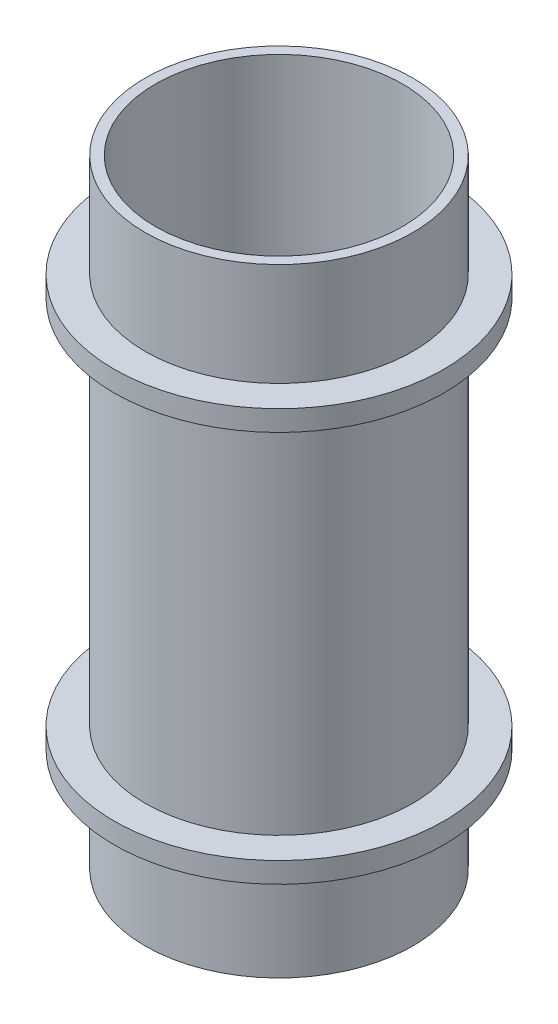
from build123d import *

# Parameters (mm, degrees)
SKETCH_1_R      = 13
SKETCH_1_R_2    = 12
EXTRUDE_1_DEPTH = 60
EXTRUDE_START   = -12
SKETCH_2_R      = 16
SKETCH_2_R_2    = 12
EXTRUDE_3_DEPTH = 2
EXTRUDE_START_2 = -10
SKETCH_3_R      = 16
SKETCH_3_R_2    = 12
EXTRUDE_4_DEPTH = 2


with BuildPart() as part:
    # Эскиз1 → Бобышка-Вытянуть1 (new body)
    with BuildSketch(Plane(origin=(0, 0, 0), x_dir=(1, 0, 0), z_dir=(0, 1, 0))):
        Circle(SKETCH_1_R)
        Circle(SKETCH_1_R_2, mode=Mode.SUBTRACT)
    extrude(amount=EXTRUDE_1_DEPTH)

    # Эскиз2 → Бобышка-Вытянуть3 (add)
    with BuildSketch(Plane(origin=(0, 60, 0), x_dir=(1, 0, 0), z_dir=(0, 1, 0)).offset(EXTRUDE_START)):
        Circle(SKETCH_2_R)
        Circle(SKETCH_2_R_2, mode=Mode.SUBTRACT)
    extrude(amount=EXTRUDE_3_DEPTH)

    # Эскиз3 → Бобышка-Вытянуть4 (add)
    with BuildSketch(Plane.XZ.offset(EXTRUDE_START_2)):
        Circle(SKETCH_3_R)
        Circle(SKETCH_3_R_2, mode=Mode.SUBTRACT)
    extrude(amount=-EXTRUDE_4_DEPTH)


solid = part.part
